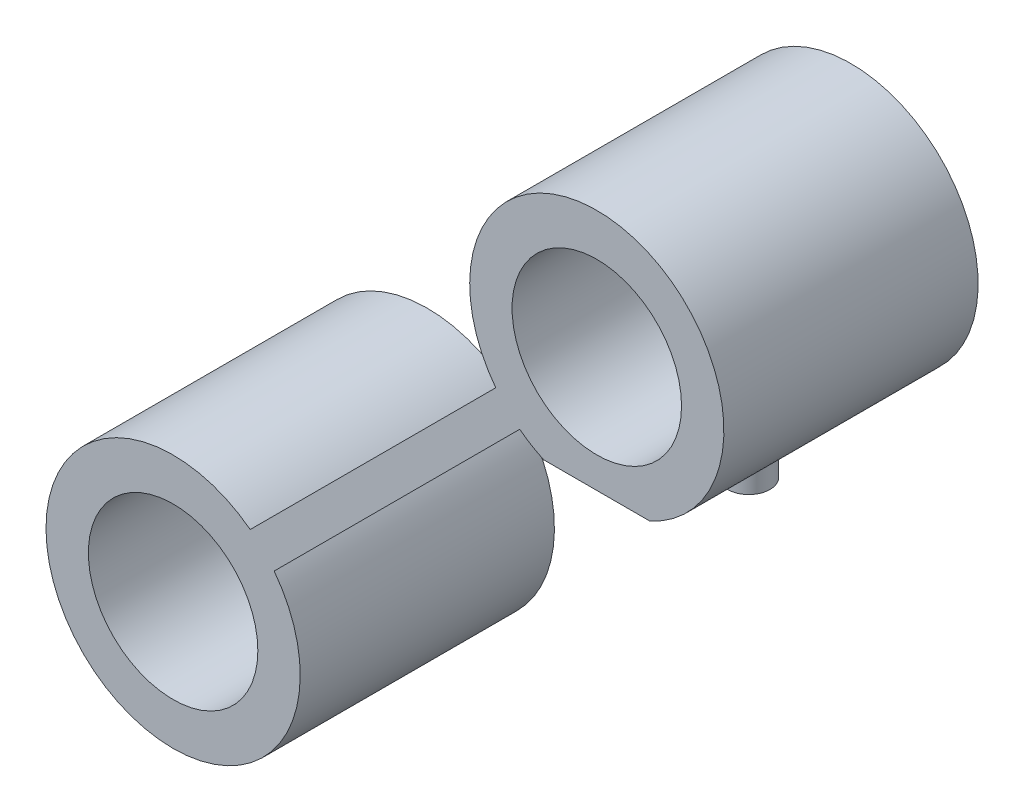
from build123d import *

# Parameters (mm, degrees)
SKETCH_1_R          = 15
SKETCH_1_R_2        = 10
EXTRUDE_1_DEPTH     = 30
CUT_EXTRUDE_START   = -30
CUT_EXTRUDE_1_DEPTH = 30
SKETCH_3_R          = 2.5
EXTRUDE_2_DEPTH     = 8


# Read off the part's stored shape, not the designer's step: 切除-拉伸1
with BuildPart() as part:
    # 草图1 → 凸台-拉伸1 (new body)
    # profile 1 of 3: a face of its own
    with BuildSketch(Plane.XY):
        Circle(SKETCH_1_R)
        Circle(SKETCH_1_R_2, mode=Mode.SUBTRACT)
    # profile 2 of 3: a face of its own
    with BuildSketch(Plane.XY):
        with BuildLine():
            ThreePointArc((40.902315542, 38.073888417), (39.393398282, 39.393398282), (38.073888417, 40.902315542))
            Line((38.073888417, 40.902315542), (9.097684458, 11.926111583))
            ThreePointArc((9.097684458, 11.926111583), (10.606601718, 10.606601718), (11.926111583, 9.097684458))
            Line((11.926111583, 9.097684458), (40.902315542, 38.073888417))
        make_face()
    # profile 3 of 3: a face of its own
    with BuildSketch(Plane.XY):
        with Locations((50, 50)):
            Circle(SKETCH_1_R)
        with Locations((50, 50)):
            Circle(SKETCH_1_R_2, mode=Mode.SUBTRACT)
    extrude(amount=EXTRUDE_1_DEPTH)

    # 切除-拉伸1 outline → 切除-拉伸1 (cut)
    with BuildSketch(Plane.XY.offset(30).offset(CUT_EXTRUDE_START)):
        with BuildLine():
            Line((56.261708011, 36.3694823), (43.738291989, 36.3694823))
            ThreePointArc((43.738291989, 36.3694823), (50, 35), (56.261708011, 36.3694823))
        make_face()
    extrude(amount=CUT_EXTRUDE_1_DEPTH, mode=Mode.SUBTRACT)

    # 草图3 → 凸台-拉伸2 (add)
    with BuildSketch(Plane(origin=(0, 36.369482299, 0), x_dir=(-1, 0, 0), z_dir=(0, -1, 0))):
        with Locations(Location((-49.626061582, -11.687427951, 0), (0, 0, 90))):
            Circle(SKETCH_3_R)
    extrude(amount=EXTRUDE_2_DEPTH)


solid = part.part
